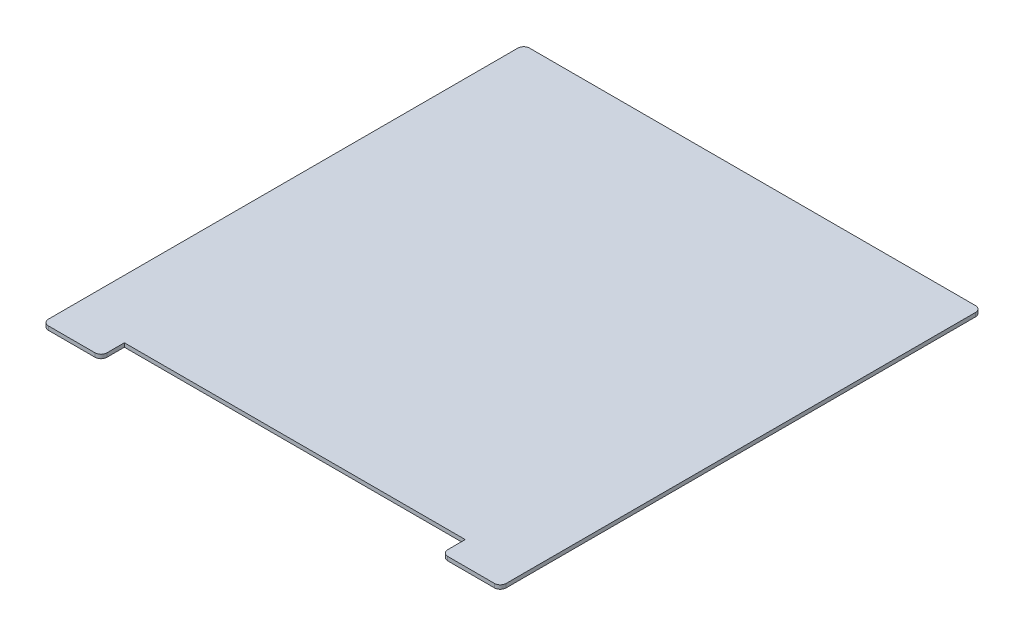
from build123d import *

# Parameters (mm, degrees)
BOSS_EXTRUDE1_DEPTH = 2
FILLET1_R           = 3


with BuildPart() as part:
    # Sketch1 → Boss-Extrude1 (new body)
    with BuildSketch(Plane(origin=(0, 0, 0), x_dir=(1, 0, 0), z_dir=(0, 1, 0))):
        Polygon((-175, -197.649746193), (-175, -185.649746193), (0, -185.649746193), (0, -197.649746193), (30, -197.649746193), (30, 49.350253807), (-205, 49.350253807), (-205, -197.649746193), align=None)
    extrude(amount=BOSS_EXTRUDE1_DEPTH)

    # Fillet1
    fillet1_edges = [part.edges().sort_by_distance(p)[0] for p in [
        (30, 1, -49.350253807),
        (-205, 1, -49.350253807),
        (-175, 1, 197.649746193),
        (-205, 1, 197.649746193),
        (30, 1, 197.649746193),
        (0, 1, 197.649746193),
    ]]
    fillet(fillet1_edges, radius=FILLET1_R)


solid = part.part
